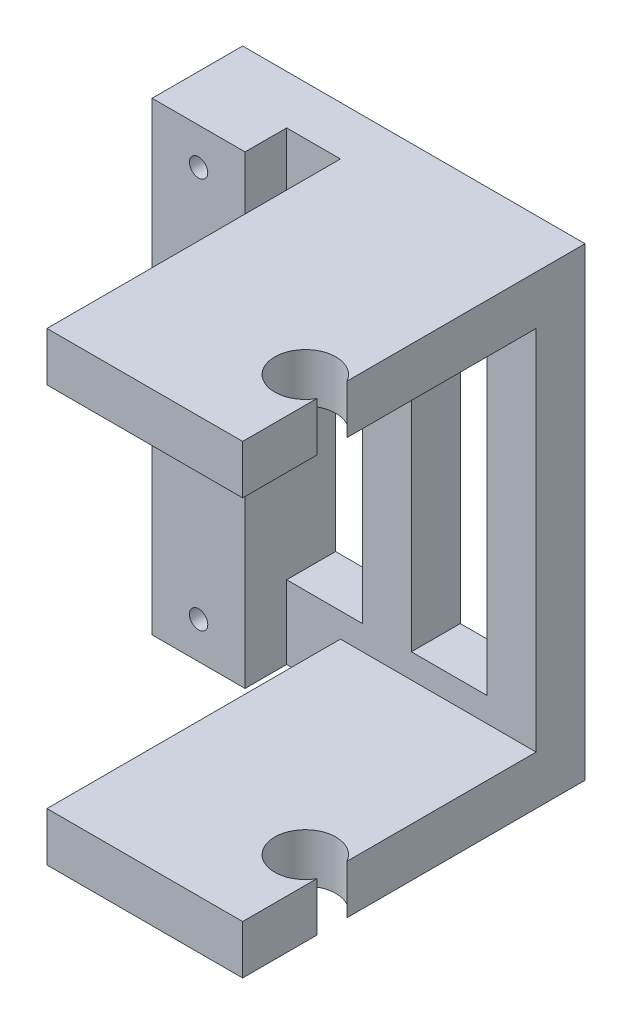
from build123d import *

# Parameters (mm, degrees)
SKETCH_2_W          = 14
SKETCH_2_H          = 19
SKETCH_2_W_2        = 3.1
SKETCH_2_H_2        = 13
EXTRUDE_1_DEPTH     = 2
SKETCH_3_W          = 8
SKETCH_3_H          = 2
EXTRUDE_2_DEPTH     = 12
SKETCH_10_W         = 3.8
SKETCH_10_H         = 19
EXTRUDE_4_DEPTH     = 1.7
CUT_EXTRUDE_2_REACH = 20.924
CUT_EXTRUDE_START   = 1.7
SKETCH_9_R          = 0.375
SKETCH_11_R         = 1.25
CUT_EXTRUDE_3_DEPTH = 25.887948891


with BuildPart() as part:
    # 草图2 → 凸台-拉伸1 (new body)
    with BuildSketch(Plane.XY):
        with Locations((-0.9, 0)):
            Rectangle(SKETCH_2_W, SKETCH_2_H)
        with Locations((-2.55, 0)):
            Rectangle(SKETCH_2_W_2, SKETCH_2_H_2, mode=Mode.SUBTRACT)
        with Locations((2.55, 0)):
            Rectangle(SKETCH_2_W_2, SKETCH_2_H_2, mode=Mode.SUBTRACT)
    extrude(amount=EXTRUDE_1_DEPTH)

    # 草图3 → 凸台-拉伸2 (add)
    with BuildSketch(Plane.XY.offset(2)):
        with Locations((2.1, 8.5)):
            Rectangle(SKETCH_3_W, SKETCH_3_H)
        with Locations((2.1, -8.5)):
            Rectangle(SKETCH_3_W, SKETCH_3_H)
    extrude(amount=EXTRUDE_2_DEPTH)

    # 草图10 → 凸台-拉伸4 (add)
    with BuildSketch(Plane.XY.offset(2)):
        with Locations((-6, 0)):
            Rectangle(SKETCH_10_W, SKETCH_10_H)
    extrude(amount=EXTRUDE_4_DEPTH)

    # 草图9 → 切除-拉伸2 (cut, up to next)
    with BuildSketch(Plane.XY.offset(2).offset(CUT_EXTRUDE_START), mode=Mode.PRIVATE) as cut_extrude_2_sk1:
        with Locations((-6, 8)):
            Circle(SKETCH_9_R)
    cut_extrude_2_tool1 = extrude(cut_extrude_2_sk1.sketch, amount=-CUT_EXTRUDE_2_REACH, mode=Mode.PRIVATE) & part.part
    # 草图9 → 切除-拉伸2 (cut, up to next)
    with BuildSketch(Plane.XY.offset(2).offset(CUT_EXTRUDE_START), mode=Mode.PRIVATE) as cut_extrude_2_sk2:
        with Locations((-6, -8)):
            Circle(SKETCH_9_R)
    cut_extrude_2_tool2 = extrude(cut_extrude_2_sk2.sketch, amount=-CUT_EXTRUDE_2_REACH, mode=Mode.PRIVATE) & part.part
    add(cut_extrude_2_tool1.solids().sort_by_distance((-6, 8, 3.7))[0], mode=Mode.SUBTRACT)
    add(cut_extrude_2_tool2.solids().sort_by_distance((-6, -8, 3.7))[0], mode=Mode.SUBTRACT)

    # 草图11 → 切除-拉伸3 (cut, through all)
    with BuildSketch(Plane.XZ.offset(9.5)):
        with Locations((5.013494235, 10.350555193)):
            Circle(SKETCH_11_R)
    extrude(amount=-CUT_EXTRUDE_3_DEPTH, mode=Mode.SUBTRACT)


solid = part.part
